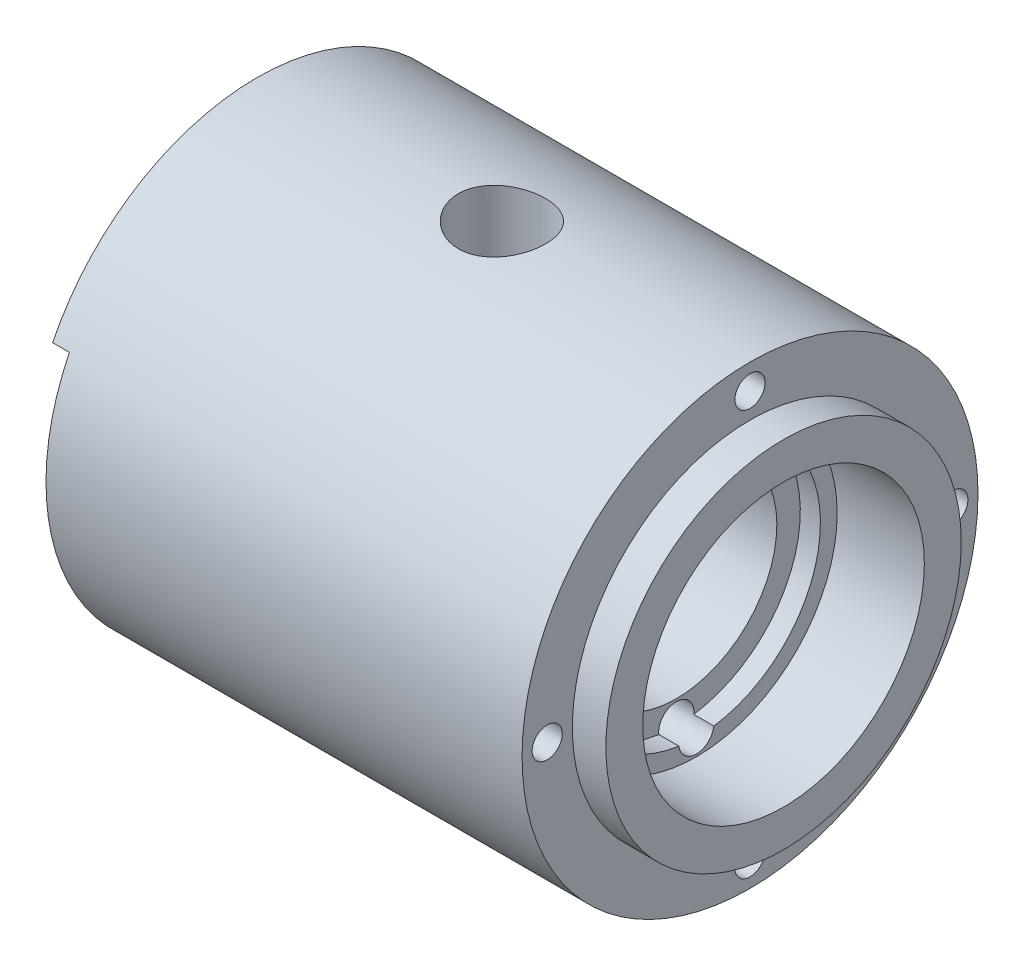
from build123d import *

# Parameters (mm, degrees)
SKETCH1_R                          = 68
BOSS_EXTRUDE1_DEPTH                = 157
CUT_EXTRUDE1_REACH                 = 186.111
SKETCH2_R                          = 26
SKETCH3_W                          = 136
SKETCH3_H                          = 98
CUT_EXTRUDE2_DEPTH                 = 5
CUT_EXTRUDE3_DEPTH                 = 44
SKETCH7_R                          = 42
CUT_EXTRUDE4_DEPTH                 = 26
SKETCH8_R                          = 37
CUT_EXTRUDE5_DEPTH                 = 6
SKETCH9_R                          = 30
CUT_EXTRUDE6_DEPTH                 = 28
CUT_EXTRUDE9_START                 = -10
SKETCH27_R                         = 68
SKETCH27_R_2                       = 53
CUT_EXTRUDE9_DEPTH                 = 10
TAP_DRILL_FOR_M1_2X0_25_TAP1_D     = 26
TAP_DRILL_FOR_M1_2X0_25_TAP1_DEPTH = 68
M8_CLEARANCE_HOLE1_D               = 9
M8_CLEARANCE_HOLE1_DEPTH           = 35
M8_CLEARANCE_HOLE1_TIP             = 2.703872786
M10_CLEARANCE_HOLE1_D              = 10.5
M10_CLEARANCE_HOLE1_DEPTH          = 15


with BuildPart() as part:
    # Sketch1 → Boss-Extrude1 (new body)
    with BuildSketch(Plane(origin=(0, 0, 0), x_dir=(0, 0, -1), z_dir=(1, 0, 0))):
        Circle(SKETCH1_R)
    extrude(amount=BOSS_EXTRUDE1_DEPTH)

    # Sketch2 → Cut-Extrude1 (cut, up to next)
    with BuildSketch(Plane.ZY, mode=Mode.PRIVATE) as cut_extrude1_sk1:
        Circle(SKETCH2_R)
    cut_extrude1_tool1 = extrude(cut_extrude1_sk1.sketch, amount=-CUT_EXTRUDE1_REACH, mode=Mode.PRIVATE) & part.part
    add(cut_extrude1_tool1.solids().sort_by_distance((0, 0, 0))[0], mode=Mode.SUBTRACT)

    # Sketch3 → Cut-Extrude2 (cut)
    with BuildSketch(Plane.ZY):
        with Locations((0, -19)):
            Rectangle(SKETCH3_W, SKETCH3_H)
    extrude(amount=-CUT_EXTRUDE2_DEPTH, mode=Mode.SUBTRACT)

    # Sketch4 → Cut-Extrude3 (cut)
    with BuildSketch(Plane.ZY.offset(-5)):
        with BuildLine():
            Line((-13.5, 29.012928153), (13.5, 29.012928153))
            ThreePointArc((13.5, 29.012928153), (0, -32), (-13.5, 29.012928153))
        make_face()
    extrude(amount=-CUT_EXTRUDE3_DEPTH, mode=Mode.SUBTRACT)

    # Sketch7 → Cut-Extrude4 (cut)
    with BuildSketch(Plane(origin=(157, 0, 0), x_dir=(0, 0, -1), z_dir=(1, 0, 0))):
        Circle(SKETCH7_R)
    extrude(amount=-CUT_EXTRUDE4_DEPTH, mode=Mode.SUBTRACT)

    # Sketch8 → Cut-Extrude5 (cut)
    with BuildSketch(Plane(origin=(131, 0, 0), x_dir=(0, 0, -1), z_dir=(1, 0, 0))):
        Circle(SKETCH8_R)
    extrude(amount=-CUT_EXTRUDE5_DEPTH, mode=Mode.SUBTRACT)

    # Sketch9 → Cut-Extrude6 (cut)
    with BuildSketch(Plane(origin=(125, 0, 0), x_dir=(0, 0, -1), z_dir=(1, 0, 0))):
        Circle(SKETCH9_R)
    extrude(amount=-CUT_EXTRUDE6_DEPTH, mode=Mode.SUBTRACT)

    # Sketch27 → Cut-Extrude9 (cut)
    with BuildSketch(Plane(origin=(157, 0, 0), x_dir=(0, 0, -1), z_dir=(1, 0, 0)).offset(CUT_EXTRUDE9_START)):
        Circle(SKETCH27_R)
        Circle(SKETCH27_R_2, mode=Mode.SUBTRACT)
    extrude(amount=CUT_EXTRUDE9_DEPTH, mode=Mode.SUBTRACT)

    # Sketch36 → Cut-Revolve2 (revolve, cut)
    with BuildSketch(Plane.XY):
        Polygon((49, 29), (60, 40), (86, 40), (97, 29), (97, 0), (49, 0), align=None)
    revolve(axis=Axis((0, 0, 0), (1, 0, 0)), mode=Mode.SUBTRACT)

    # Tap Drill for M1.2x0.25 Tap1
    with Locations(Plane(origin=(0, 68, 0), x_dir=(1, 0, 0), z_dir=(0, 1, 0))):
        with Locations((73, 0)):
            Hole(TAP_DRILL_FOR_M1_2X0_25_TAP1_D / 2, depth=TAP_DRILL_FOR_M1_2X0_25_TAP1_DEPTH)

    # M8 Clearance Hole1
    with Locations(Plane(origin=(147, 0, 0), x_dir=(0, 0, -1), z_dir=(1, 0, 0))):
        with Locations((-60.5, 0), (0, 60.5), (60.5, 0), (0, -60.5)):
            Hole(M8_CLEARANCE_HOLE1_D / 2, depth=M8_CLEARANCE_HOLE1_DEPTH)
            with Locations((0, 0, -(M8_CLEARANCE_HOLE1_DEPTH + M8_CLEARANCE_HOLE1_TIP / 2))):  # 118° drill point
                Cone(0, M8_CLEARANCE_HOLE1_D / 2, M8_CLEARANCE_HOLE1_TIP, mode=Mode.SUBTRACT)

    # M10 Clearance Hole1
    with Locations(Plane(origin=(131, 0, 0), x_dir=(0, 0, -1), z_dir=(1, 0, 0))):
        with Locations((0, -36)):
            Hole(M10_CLEARANCE_HOLE1_D / 2, depth=M10_CLEARANCE_HOLE1_DEPTH)


solid = part.part
